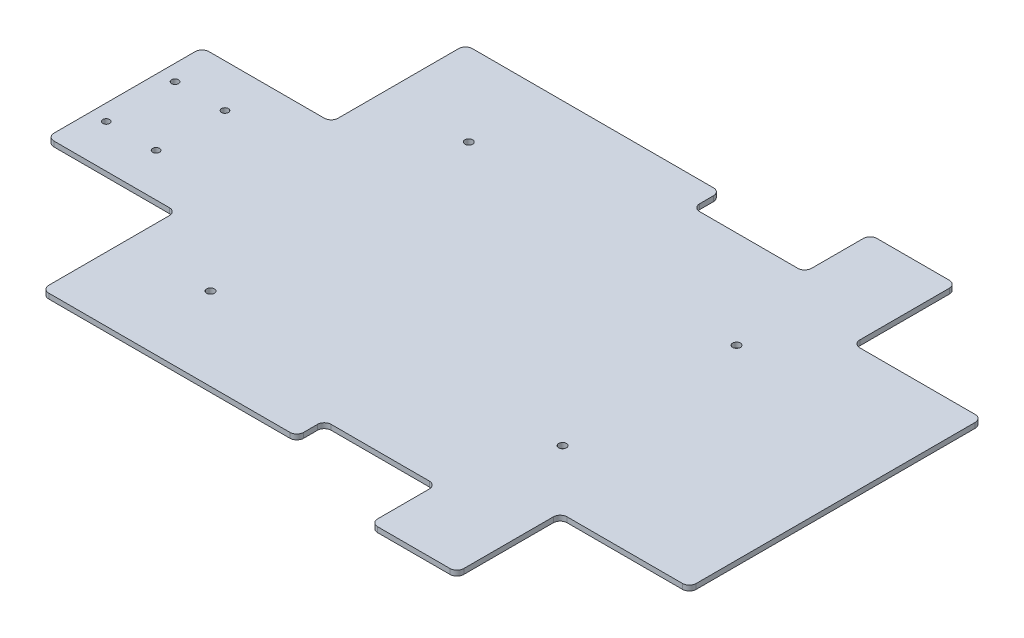
from build123d import *

# Parameters (mm, degrees)
SALIENTE_EXTRUIR1_DEPTH = 3
REDONDEO1_R             = 4
CROQUIS4_R              = 2.25
CORTAR_EXTRUIR1_DEPTH   = 10
CROQUIS5_R              = 2.25
CORTAR_EXTRUIR2_DEPTH   = 10
CROQUIS6_R              = 2
CORTAR_EXTRUIR3_DEPTH   = 4


with BuildPart() as part:
    # Croquis1 → Saliente-Extruir1 (new body)
    with BuildSketch(Plane(origin=(0, 0, 0), x_dir=(1, 0, 0), z_dir=(0, 1, 0))):
        Polygon((0, 0), (-413, 0), (-413, 45), (-338, 45), (-338, 123), (-190, 123), (-190, 107), (-125, 107), (-125, 145), (-75, 145), (-75, 85), (0, 85), align=None)
    saliente_extruir1 = extrude(amount=SALIENTE_EXTRUIR1_DEPTH)

    # Simetría1: Saliente-Extruir1 across plane
    add(saliente_extruir1.mirror(Plane(origin=(0, 3, 0), x_dir=(1, 0, 0), z_dir=(0, 0, -1))))

    # Redondeo1
    redondeo1_edges = [part.edges().sort_by_distance(p)[0] for p in [
        (-413, 1.5, -45),
        (-338, 1.5, -45),
        (-338, 1.5, -123),
        (-190, 1.5, -123),
        (-190, 1.5, -107),
        (-125, 1.5, -107),
        (-125, 1.5, -145),
        (-75, 1.5, -85),
        (-75, 1.5, -145),
        (0, 1.5, -85),
        (0, 1.5, 85),
        (-75, 1.5, 85),
        (-75, 1.5, 145),
        (-125, 1.5, 145),
        (-125, 1.5, 107),
        (-190, 1.5, 107),
        (-190, 1.5, 123),
        (-338, 1.5, 123),
        (-338, 1.5, 45),
        (-413, 1.5, 45),
    ]]
    fillet(redondeo1_edges, radius=REDONDEO1_R)

    # Croquis4 → Cortar-Extruir1 (cut)
    with BuildSketch(Plane(origin=(0, 3, 0), x_dir=(1, 0, 0), z_dir=(0, 1, 0))):
        with Locations((-108.1, -50.5)):
            Circle(CROQUIS4_R)
    cortar_extruir1 = extrude(amount=-CORTAR_EXTRUIR1_DEPTH, mode=Mode.SUBTRACT)

    # Simetría2: Cortar-Extruir1 across plane
    add(cortar_extruir1.mirror(Plane.XY), mode=Mode.SUBTRACT)

    # Croquis5 → Cortar-Extruir2 (cut)
    with BuildSketch(Plane(origin=(0, 3, 0), x_dir=(1, 0, 0), z_dir=(0, 1, 0))):
        with Locations((-288.1, -75)):
            Circle(CROQUIS5_R)
    cortar_extruir2 = extrude(amount=-CORTAR_EXTRUIR2_DEPTH, mode=Mode.SUBTRACT)

    # Simetría3: Cortar-Extruir2 across plane
    add(cortar_extruir2.mirror(Plane.XY), mode=Mode.SUBTRACT)

    # Croquis6 → Cortar-Extruir3 (cut)
    with BuildSketch(Plane(origin=(0, 3, 0), x_dir=(1, 0, 0), z_dir=(0, 1, 0))):
        with Locations((-374.7, 20)):
            Circle(CROQUIS6_R)
        with Locations((-403.7, 20)):
            Circle(CROQUIS6_R)
        with Locations((-374.7, -19.99899972)):
            Circle(CROQUIS6_R)
        with Locations((-403.7, -19.99899972)):
            Circle(CROQUIS6_R)
    extrude(amount=-CORTAR_EXTRUIR3_DEPTH, mode=Mode.SUBTRACT)


solid = part.part
